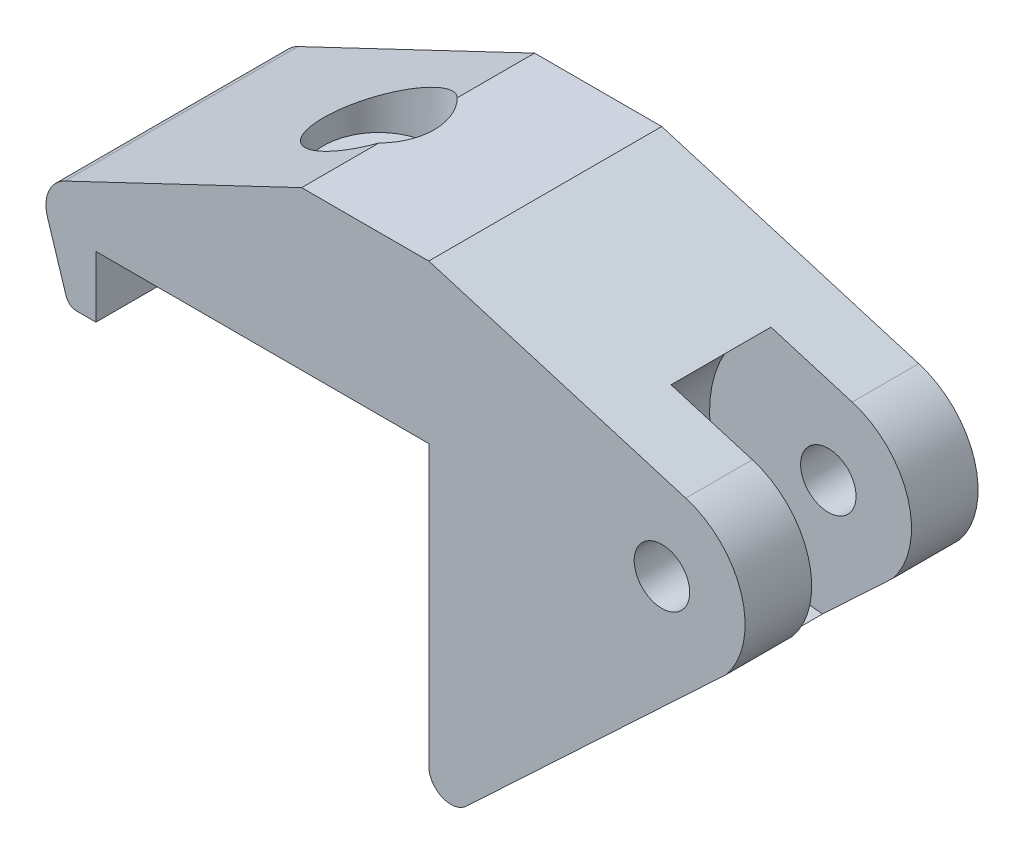
from build123d import *
from build123d.topology import SkipClean

# Parameters (mm, degrees)
RESSALTO_EXTRUS_O1_DEPTH     = 6
RESSALTO_EXTRUS_O2_DEPTH     = 47.171573
CORTE_EXTRUS_O1_START        = -36
CORTE_EXTRUS_O1_DEPTH        = 36
CORTE_EXTRUS_O2_START        = -6
CORTE_EXTRUS_O2_DEPTH        = 6
CORTE_EXTRUS_O3_DEPTH        = 64.000000167
ESBO_O6_R                    = 2.75
CORTE_EXTRUS_O4_DEPTH        = 54.872946739
ESBO_O7_R                    = 5
CORTE_EXTRUS_O5_DEPTH        = 16
RESSALTO_EXTRUS_O3_DEPTH     = 56
CORTE_EXTRUS_O6_DEPTH        = 56
ESBO_O10_W                   = 30
ESBO_O10_H                   = 4.954017116
CORTE_EXTRUS_O7_DEPTH        = 56
ESBO_O11_W                   = 2.729993951
ESBO_O11_H                   = 30
CORTE_EXTRUS_O8_DEPTH        = 56
ESBO_O12_W                   = 4.187219241
ESBO_O12_H                   = 30
CORTE_EXTRUS_O9_DEPTH        = 56
ESBO_O13_R                   = 7.968110823
CORTE_EXTRUS_O10_DEPTH       = 56
FILETE1_R                    = 3
CORTE_EXTRUS_O11_OUTLINE_R   = 5
CORTE_EXTRUS_O11_DEPTH       = 11.574929357
CORTE_EXTRUS_O11_START       = -21
CORTE_EXTRUS_O11_2_DEPTH     = 28
CORTE_EXTRUS_O12_DEPTH       = 65.838260479
ESBO_O16_R                   = 2.5
RESSALTO_EXTRUS_O4_DEPTH     = 6
RESSALTO_EXTRUS_O5_DEPTH     = 32
CORTE_EXTRUS_O13_DEPTH       = 68.468511346
CORTE_EXTRUS_O13_DEPTH_BACK  = 68.468511346
RESSALTO_EXTRUS_O6_START     = -12
RESSALTO_EXTRUS_O6_OUTLINE_R = 2.5
RESSALTO_EXTRUS_O6_DEPTH     = 6
CORTE_EXTRUS_O14_START       = -6
CORTE_EXTRUS_O14_DEPTH       = 6
RESSALTO_EXTRUS_O7_START     = 12
RESSALTO_EXTRUS_O7_DEPTH     = 12
ESBO_O22_R                   = 45.252609104
CORTE_EXTRUS_O15_DEPTH       = 12
RESSALTO_EXTRUS_O8_START     = 6
ESBO_O23_R                   = 2.5
RESSALTO_EXTRUS_O8_DEPTH     = 6
RESSALTO_EXTRUS_O9_DEPTH     = 6
RESSALTO_EXTRUS_O10_REACH    = 56.275
ESBO_O26_R                   = 5
CORTE_EXTRUS_O16_DEPTH       = 47.409919189
ESBO_O27_R                   = 5
ESBO_O27_R_2                 = 2.582746485
RESSALTO_EXTRUS_O11_DEPTH    = 8


with BuildPart() as part:
    # Esboço1 → Ressalto-extrusão1 (new body)
    with BuildSketch(Plane.XY):
        with BuildLine():
            Line((-30, 24), (-2.375117905, 40.574929257))
            ThreePointArc((-2.375117905, 40.574929257), (0.100503831, 41.637149282), (2.769839649, 42))
            Line((2.769839649, 42), (40, 42))
            ThreePointArc((40, 42), (41.414213562, 41.414213562), (42, 40))
            Line((42, 40), (42, 34.828427125))
            ThreePointArc((42, 34.828427125), (41.847759065, 34.06306026), (41.414213562, 33.414213562))
            Line((41.414213562, 33.414213562), (36.670641482, 28.670641482))
            ThreePointArc((36.670641482, 28.670641482), (31.432958847, 25.911210894), (25.552715472, 26.597151419))
            ThreePointArc((25.552715472, 26.597151419), (13.045048712, 24.264475098), (10.712372391, 11.756808337))
            ThreePointArc((10.712372391, 11.756808337), (11.398312916, 5.876564962), (8.638882328, 0.638882328))
            Line((8.638882328, 0.638882328), (8, 0))
            Line((8, 0), (6.2, -1.8))
            Line((6.2, -1.8), (3.414213562, -4.585786438))
            ThreePointArc((3.414213562, -4.585786438), (1.234633135, -5.01933194), (0, -3.171572875))
            Line((0, -3.171572875), (0, 0))
            Line((0, 0), (0, 22))
            Line((0, 22), (-30, 22))
            Line((-30, 22), (-30, 24))
        make_face()
        with BuildLine():
            Line((6.2, 37.5), (6.2, 34.5))
            ThreePointArc((6.2, 34.5), (4.5, 32.8), (2.8, 34.5))
            Line((2.8, 34.5), (2.8, 37.5))
            ThreePointArc((2.8, 37.5), (4.5, 39.2), (6.2, 37.5))
        make_face(mode=Mode.SUBTRACT)
        with BuildLine():
            Line((39.2, 37.5), (39.2, 35.5))
            ThreePointArc((39.2, 35.5), (37.5, 33.8), (35.8, 35.5))
            Line((35.8, 35.5), (35.8, 37.5))
            ThreePointArc((35.8, 37.5), (37.5, 39.2), (39.2, 37.5))
        make_face(mode=Mode.SUBTRACT)
        with BuildLine():
            Line((6.2, 3.5), (6.2, 1.5))
            ThreePointArc((6.2, 1.5), (4.5, -0.2), (2.8, 1.5))
            Line((2.8, 1.5), (2.8, 3.5))
            ThreePointArc((2.8, 3.5), (4.5, 5.2), (6.2, 3.5))
        make_face(mode=Mode.SUBTRACT)
    extrude(amount=RESSALTO_EXTRUS_O1_DEPTH)

    # Esboço2 → Ressalto-extrusão2 (add, through all)
    with BuildSketch(Plane(origin=(0, 42, 0), x_dir=(1, 0, 0), z_dir=(0, 1, 0))):
        with BuildLine():
            Line((-30, 0), (-30, 20))
            ThreePointArc((-30, 20), (5.092783278, 6.734019802), (42, 0))
            Line((42, 0), (-30, 0))
        make_face()
    extrude(amount=-RESSALTO_EXTRUS_O2_DEPTH)

    # Esboço3 → Corte-extrusão1 (cut)
    with BuildSketch(Plane.XY.offset(CORTE_EXTRUS_O1_START)):
        with BuildLine():
            ThreePointArc((2.8, 34.5), (4.5, 32.8), (6.2, 34.5))
            Line((6.2, 34.5), (6.2, 37.5))
            ThreePointArc((6.2, 37.5), (4.5, 39.2), (2.8, 37.5))
            Line((2.8, 37.5), (2.8, 34.5))
        make_face()
        with BuildLine():
            Line((0, -3.171572875), (0, 22))
            Line((0, 22), (-30, 22))
            Line((-30, 22), (-30, -5.171572875))
            Line((-30, -5.171572875), (2, -5.171572875))
            ThreePointArc((2, -5.171572875), (0.585786438, -4.585786438), (0, -3.171572875))
        make_face()
        with BuildLine():
            ThreePointArc((3.414213562, -4.585786438), (2.765366865, -5.01933194), (2, -5.171572875))
            Line((2, -5.171572875), (42, -5.171572875))
            Line((42, -5.171572875), (42, 34.828427125))
            ThreePointArc((42, 34.828427125), (41.847759065, 34.06306026), (41.414213562, 33.414213562))
            Line((41.414213562, 33.414213562), (36.670641482, 28.670641482))
            ThreePointArc((36.670641482, 28.670641482), (31.432958847, 25.911210894), (25.552715472, 26.597151419))
            ThreePointArc((25.552715472, 26.597151419), (13.045048712, 24.264475098), (10.712372391, 11.756808337))
            ThreePointArc((10.712372391, 11.756808337), (11.398312916, 5.876564962), (8.638882328, 0.638882328))
            Line((8.638882328, 0.638882328), (3.414213562, -4.585786438))
        make_face()
        with BuildLine():
            ThreePointArc((35.8, 35.5), (37.5, 33.8), (39.2, 35.5))
            Line((39.2, 35.5), (39.2, 37.5))
            ThreePointArc((39.2, 37.5), (37.5, 39.2), (35.8, 37.5))
            Line((35.8, 37.5), (35.8, 35.5))
        make_face()
        with BuildLine():
            ThreePointArc((2.8, 1.5), (4.5, -0.2), (6.2, 1.5))
            Line((6.2, 1.5), (6.2, 3.5))
            ThreePointArc((6.2, 3.5), (4.5, 5.2), (2.8, 3.5))
            Line((2.8, 3.5), (2.8, 1.5))
        make_face()
        with BuildLine():
            Line((-30, 42), (-30, 24))
            Line((-30, 24), (-2.375117905, 40.574929257))
            ThreePointArc((-2.375117905, 40.574929257), (0.100503831, 41.637149282), (2.769839649, 42))
            Line((2.769839649, 42), (-30, 42))
        make_face()
    extrude(amount=CORTE_EXTRUS_O1_DEPTH, mode=Mode.SUBTRACT)

    # Esboço4 → Corte-extrusão2 (cut)
    with BuildSketch(Plane.XY.offset(CORTE_EXTRUS_O2_START)):
        with BuildLine():
            Line((42, 40), (42, 42))
            Line((42, 42), (40, 42))
            ThreePointArc((40, 42), (41.414213562, 41.414213562), (42, 40))
        make_face()
    extrude(amount=CORTE_EXTRUS_O2_DEPTH, mode=Mode.SUBTRACT)

    # Esboço5 → Corte-extrusão3 (cut, through all)
    with BuildSketch(Plane.XY.offset(1)):
        with BuildLine():
            Line((1.3, 37.5), (1.3, 34.5))
            ThreePointArc((1.3, 34.5), (4.5, 31.3), (7.7, 34.5))
            Line((7.7, 34.5), (7.7, 37.5))
            ThreePointArc((7.7, 37.5), (4.5, 40.7), (1.3, 37.5))
        make_face()
        with BuildLine():
            Line((40.2, 35.5), (40.2, 37.5))
            ThreePointArc((40.2, 37.5), (37.5, 40.2), (34.8, 37.5))
            Line((34.8, 37.5), (34.8, 35.5))
            ThreePointArc((34.8, 35.5), (37.5, 32.8), (40.2, 35.5))
        make_face()
        with BuildLine():
            Line((1.8, 3.5), (1.8, 1.5))
            ThreePointArc((1.8, 1.5), (4.5, -1.2), (7.2, 1.5))
            Line((7.2, 1.5), (7.2, 3.5))
            ThreePointArc((7.2, 3.5), (4.5, 6.2), (1.8, 3.5))
        make_face()
    extrude(amount=-CORTE_EXTRUS_O3_DEPTH, mode=Mode.SUBTRACT)

    # Esboço6 → Corte-extrusão4 (cut, through all)
    with BuildSketch(Plane.XZ.offset(-22)):
        with Locations((-15, -3)):
            Circle(ESBO_O6_R)
    extrude(amount=-CORTE_EXTRUS_O4_DEPTH, mode=Mode.SUBTRACT)

    # Esboço7 → Corte-extrusão5 (cut)
    with BuildSketch(Plane(origin=(0, 29, 0), x_dir=(-1, 0, 0), z_dir=(0, -1, 0))):
        with Locations(Location((15, 3, 0), (0, 0, 180))):
            Circle(ESBO_O7_R)
    extrude(amount=-CORTE_EXTRUS_O5_DEPTH, mode=Mode.SUBTRACT)

    # Esboço8 → Ressalto-extrusão3 (add)
    with BuildSketch(Plane.XY.offset(6)):
        Polygon((-30, 22), (-30, 16.475897374), (-32.468121282, 16.475897374), (-35.151943697, 24.974668355), (-2.375117905, 40.574929257), align=None)
    extrude(amount=-RESSALTO_EXTRUS_O3_DEPTH)

    # Esboço9 → Corte-extrusão6 (cut)
    with BuildSketch(Plane(origin=(-19.527562648, 29.041651157, 0), x_dir=(0.8298484461977135, 0.5579888496585221, 0), z_dir=(0.5579888496585221, -0.8298484461977135, 0))):
        with BuildLine():
            Line((20.669370198, -50), (20.669370198, -8.960218673))
            add(Edge.make_bspline(
                [(20.669370198, -8.960218673), (3.547051305, -13.487974371), (-12.619698693, -20)],
                knots=[1.879279318, 1.879279318, 1.879279318, 2.02269118, 2.02269118, 2.02269118], degree=2, weights=[1, 0.997430231, 1]))
            Line((-12.619698693, -20), (-12.619698693, -50))
            Line((-12.619698693, -50), (20.669370198, -50))
        make_face()
    extrude(amount=-CORTE_EXTRUS_O6_DEPTH, mode=Mode.SUBTRACT)

    # Esboço10 → Corte-extrusão7 (cut)
    with BuildSketch(Plane(origin=(-10.472437352, -7.041651157, 0), x_dir=(0, 0, -1), z_dir=(0.8298484461977135, 0.5579888496585221, 1.5073885260129385e-15))):
        with Locations((35, 37.473339864)):
            Rectangle(ESBO_O10_W, ESBO_O10_H)
    extrude(amount=-CORTE_EXTRUS_O7_DEPTH, mode=Mode.SUBTRACT)

    # Esboço11 → Corte-extrusão8 (cut)
    with BuildSketch(Plane(origin=(-22.291848959, 33.152734563, 0), x_dir=(0.8298484461977135, 0.5579888496585221, 0), z_dir=(0.5579888496585221, -0.8298484461977135, 0))):
        with Locations((-13.984695669, -35)):
            Rectangle(ESBO_O11_W, ESBO_O11_H)
    extrude(amount=-CORTE_EXTRUS_O8_DEPTH, mode=Mode.SUBTRACT)

    # Esboço12 → Corte-extrusão9 (cut)
    with BuildSketch(Plane(origin=(-19.527562648, 29.041651157, 0), x_dir=(0.8298484461977135, 0.5579888496585221, 0), z_dir=(-0.5579888496585221, 0.8298484461977135, 0))):
        with Locations((-14.713308314, 35)):
            Rectangle(ESBO_O12_W, ESBO_O12_H)
    extrude(amount=-CORTE_EXTRUS_O9_DEPTH, mode=Mode.SUBTRACT)

    # Esboço13 → Corte-extrusão10 (cut)
    with BuildSketch(Plane(origin=(0, 0, -20), x_dir=(-1, 0, 0), z_dir=(0, 0, -1))):
        with Locations((34.361612589, 20.650995678)):
            Circle(ESBO_O13_R)
    extrude(amount=CORTE_EXTRUS_O10_DEPTH, mode=Mode.SUBTRACT)

    # Filete1
    filete1_edges = [part.edges().sort_by_distance(p)[0] for p in [
        (-35.151943697, 24.974668355, -7),
    ]]
    fillet(filete1_edges, radius=FILETE1_R)

    # Corte-extrusão11: read off the stored shape, not the designer's step
    # Corte-extrusão11 outline → Corte-extrusão11 (cut)
    with SkipClean():  # the faces are left unmerged after this step: merging them gives an invalid solid
        with BuildSketch(Plane(origin=(0, 29, 0), x_dir=(1, 0, 0), z_dir=(0, 1, 0))):
            with Locations((-15, 3)):
                Circle(CORTE_EXTRUS_O11_OUTLINE_R)
        extrude(amount=CORTE_EXTRUS_O11_DEPTH, mode=Mode.SUBTRACT)

    # Corte-extrus_o11 2 outline → Corte-extrus_o11 2 (cut)
    with SkipClean():  # the faces are left unmerged after this step: merging them gives an invalid solid
        with BuildSketch(Plane.XY.offset(CORTE_EXTRUS_O11_START)):
            with BuildLine():
                ThreePointArc((-31.735233974, 16.475897374), (-32.326363669, 16.669320853), (-32.688816639, 17.174766006))
                Line((-32.688816639, 17.174766006), (-32.468121282, 16.475897374))
                Line((-32.468121282, 16.475897374), (-31.735233974, 16.475897374))
            make_face()
        extrude(amount=CORTE_EXTRUS_O11_2_DEPTH, mode=Mode.SUBTRACT)

    # Esboço15 → Corte-extrusão12 (cut, through all)
    with SkipClean():  # the faces are left unmerged after this step: merging them gives an invalid solid
        with BuildSketch(Plane.XY.offset(6)):
            with BuildLine():
                Line((9.75, 16.30952381), (10, 22.2))
                ThreePointArc((10, 22.2), (16.149553965, 32.072850311), (27.722395139, 30.906859571))
                ThreePointArc((27.722395139, 30.906859571), (33.400143909, 29.493959096), (39.042427522, 31.042427522))
                Line((39.042427522, 31.042427522), (40.056737405, 6.935592927))
                Line((40.056737405, 6.935592927), (14.498143353, 9.675700977))
                Line((14.498143353, 9.675700977), (9.75, 16.30952381))
            make_face()
        extrude(amount=-CORTE_EXTRUS_O12_DEPTH, mode=Mode.SUBTRACT)

    # Esboço16 → Ressalto-extrusão4 (add)
    # profile 1 of 2: a face of its own
    with SkipClean():  # the faces are left unmerged after this step: merging them gives an invalid solid
        with BuildSketch(Plane.XY.offset(6)):
            with BuildLine():
                Line((8.638882328, 0.638882328), (3.414213562, -4.585786438))
                Line((3.414213562, -4.585786438), (25.426690476, 16.071039138))
                Line((25.426690476, 16.071039138), (26.790546671, 17.350901447))
                ThreePointArc((26.790546671, 17.350901447), (28.194594299, 24.31086023), (23.165446705, 29.322850901))
                Line((23.165446705, 29.322850901), (15.374722386, 31.652843581))
                ThreePointArc((15.374722386, 31.652843581), (11.437624412, 27.637000379), (10, 22.2))
                Line((10, 22.2), (9.79045574, 17.262738097))
                ThreePointArc((9.79045574, 17.262738097), (9.904464176, 14.45167969), (10.712372391, 11.756808337))
                ThreePointArc((10.712372391, 11.756808337), (11.398312916, 5.876564962), (8.638882328, 0.638882328))
            make_face()
            with Locations((21.016451551, 22.137322401)):
                Circle(ESBO_O16_R, mode=Mode.SUBTRACT)
        # profile 2 of 2: a face of its own
        with BuildSketch(Plane.XY.offset(6)):
            with BuildLine():
                ThreePointArc((0, -3.171572875), (1.234633135, -5.01933194), (3.414213562, -4.585786438))
                Line((3.414213562, -4.585786438), (8.638882328, 0.638882328))
                ThreePointArc((8.638882328, 0.638882328), (11.398312916, 5.876564962), (10.712372391, 11.756808337))
                ThreePointArc((10.712372391, 11.756808337), (9.904464176, 14.45167969), (9.79045574, 17.262738097))
                Line((9.79045574, 17.262738097), (10, 22.2))
                ThreePointArc((10, 22.2), (11.437624412, 27.637000379), (15.374722386, 31.652843581))
                Line((15.374722386, 31.652843581), (6.196917621, 34.397674105))
                ThreePointArc((6.196917621, 34.397674105), (4.448813845, 32.80077077), (2.8, 34.5))
                Line((2.8, 34.5), (2.8, 35.413599309))
                Line((2.8, 35.413599309), (0, 36.251002769))
                Line((0, 36.251002769), (-11.459875276, 36.251002769))
                Line((-11.459875276, 36.251002769), (-32.794151025, 26.096869176))
                ThreePointArc((-32.794151025, 26.096869176), (-34.255821628, 24.584817567), (-34.365620501, 22.484644901))
                Line((-34.365620501, 22.484644901), (-32.688816639, 17.174766006))
                ThreePointArc((-32.688816639, 17.174766006), (-32.326363669, 16.669320853), (-31.735233974, 16.475897374))
                Line((-31.735233974, 16.475897374), (-30, 16.475897374))
                Line((-30, 16.475897374), (-30, 22))
                Line((-30, 22), (0, 22))
                Line((0, 22), (0, -3.171572875))
            make_face()
            with BuildLine():
                Line((2.8, 1.5), (2.8, 3.5))
                ThreePointArc((2.8, 3.5), (4.5, 5.2), (6.2, 3.5))
                Line((6.2, 3.5), (6.2, 1.5))
                ThreePointArc((6.2, 1.5), (4.5, -0.2), (2.8, 1.5))
            make_face(mode=Mode.SUBTRACT)
        extrude(amount=RESSALTO_EXTRUS_O4_DEPTH)

    # Esboço17 → Ressalto-extrusão5 (add, through all)
    with SkipClean():  # the faces are left unmerged after this step: merging them gives an invalid solid
        with BuildSketch(Plane.XY.offset(12)):
            Polygon((0, 36.251002769), (10.130318386, 33.221301458), (0.975035889, 28.870604343), align=None)
            Polygon((2.084047032, 8.037037864), (2.084047032, -2.498567998), (9.054974219, 1.541401167), (7.781094017, 11.183860023), align=None)
        extrude(amount=-RESSALTO_EXTRUS_O5_DEPTH)

    # Esboço18 → Corte-extrusão13 (cut, two sides: drawn at the far end of the back side and taken through both)
    with BuildSketch(Plane.XY.offset(12).offset(-CORTE_EXTRUS_O13_DEPTH_BACK)):
        Polygon((46.622494025, 46.314856478), (-12.491527995, 46.314856478), (-11.459875276, 36.251002769), (0, 36.251002769), (23.165446705, 29.322850901), (57.534604201, 23.388039005), align=None)
    extrude(amount=CORTE_EXTRUS_O13_DEPTH + CORTE_EXTRUS_O13_DEPTH_BACK, mode=Mode.SUBTRACT)

    # Ressalto-extrusão6: read off the stored shape, not the designer's step
    # Ressalto-extrusão6 outline → Ressalto-extrusão6 (add)
    # profile 1 of 4: a face of its own
    with BuildSketch(Plane.XY.offset(12).offset(RESSALTO_EXTRUS_O6_START)):
        with BuildLine():
            Line((6.920981451, 0.304655358), (4.333572344, -1.194865829))
            ThreePointArc((4.333572344, -1.194865829), (5.853844213, -0.836044916), (6.920981451, 0.304655358))
        make_face()
    # profile 2 of 4: a face of its own
    with BuildSketch(Plane.XY.offset(12).offset(RESSALTO_EXTRUS_O6_START)):
        with BuildLine():
            Line((2.084047032, 0.294524468), (2.084047032, 4.705475532))
            ThreePointArc((2.084047032, 4.705475532), (1.871970984, 4.119244292), (1.8, 3.5))
            Line((1.8, 3.5), (1.8, 1.5))
            ThreePointArc((1.8, 1.5), (1.871970984, 0.880755708), (2.084047032, 0.294524468))
        make_face()
    # profile 3 of 4: a face of its own
    with BuildSketch(Plane.XY.offset(12).offset(RESSALTO_EXTRUS_O6_START)):
        with BuildLine():
            Line((10, 22.2), (9.79045574, 17.262738097))
            ThreePointArc((9.79045574, 17.262738097), (9.904464176, 14.45167969), (10.712372391, 11.756808337))
            ThreePointArc((10.712372391, 11.756808337), (11.398312916, 5.876564962), (8.638882328, 0.638882328))
            Line((8.638882328, 0.638882328), (3.414213562, -4.585786438))
            Line((3.414213562, -4.585786438), (26.790546671, 17.350901447))
            ThreePointArc((26.790546671, 17.350901447), (28.194594299, 24.31086023), (23.165446705, 29.322850901))
            Line((23.165446705, 29.322850901), (15.374722386, 31.652843581))
            ThreePointArc((15.374722386, 31.652843581), (11.437624412, 27.637000379), (10, 22.2))
        make_face()
        with Locations((21.016451551, 22.137322401)):
            Circle(RESSALTO_EXTRUS_O6_OUTLINE_R, mode=Mode.SUBTRACT)
    # profile 4 of 4: a face of its own
    with BuildSketch(Plane.XY.offset(12).offset(RESSALTO_EXTRUS_O6_START)):
        Polygon((-11, 36.251002769), (-11.459875276, 36.251002769), (-11.767511755, 29), (-11, 29), align=None)
    extrude(amount=RESSALTO_EXTRUS_O6_DEPTH)

    # Esboço20 → Corte-extrusão14 (cut)
    with BuildSketch(Plane.XY.offset(12).offset(CORTE_EXTRUS_O14_START)):
        with BuildLine():
            Line((-30, 22), (0, 22))
            Line((0, 22), (0, -3.171572875))
            ThreePointArc((0, -3.171572875), (1.234633135, -5.01933194), (3.414213562, -4.585786438))
            Line((3.414213562, -4.585786438), (26.790546671, 17.350901447))
            ThreePointArc((26.790546671, 17.350901447), (28.194594299, 24.31086023), (23.165446705, 29.322850901))
            Line((23.165446705, 29.322850901), (0, 36.251002769))
            Line((0, 36.251002769), (-11.459875276, 36.251002769))
            Line((-11.459875276, 36.251002769), (-32.794151025, 26.096869176))
            ThreePointArc((-32.794151025, 26.096869176), (-34.255821628, 24.584817567), (-34.365620501, 22.484644901))
            Line((-34.365620501, 22.484644901), (-32.688816639, 17.174766006))
            ThreePointArc((-32.688816639, 17.174766006), (-32.326363669, 16.669320853), (-31.735233974, 16.475897374))
            Line((-31.735233974, 16.475897374), (-30, 16.475897374))
            Line((-30, 16.475897374), (-30, 22))
        make_face()
    extrude(amount=CORTE_EXTRUS_O14_DEPTH, mode=Mode.SUBTRACT)

    # Esboço21 → Ressalto-extrusão7 (add)
    with BuildSketch(Plane(origin=(0, 0, 0), x_dir=(-1, 0, 0), z_dir=(0, 0, -1)).offset(RESSALTO_EXTRUS_O7_START)):
        with BuildLine():
            Line((-3.414213562, -4.585786438), (-20.494190423, 11.442310001))
            ThreePointArc((-20.494190423, 11.442310001), (-10.585084019, 19.720171533), (-15.84350344, 31.512643982))
            Line((-15.84350344, 31.512643982), (-15.374722386, 31.652843581))
            Line((-15.374722386, 31.652843581), (-10.130318386, 33.221301458))
            Line((-10.130318386, 33.221301458), (0, 36.251002769))
            Line((0, 36.251002769), (-3.414213562, 20.694771015))
            Line((-3.414213562, 20.694771015), (0, -3.171572875))
            ThreePointArc((0, -3.171572875), (-1.234633135, -5.01933194), (-3.414213562, -4.585786438))
        make_face()
    extrude(amount=-RESSALTO_EXTRUS_O7_DEPTH)

    # Esboço22 → Corte-extrusão15 (cut)
    with BuildSketch(Plane(origin=(0, 0, -12), x_dir=(-1, 0, 0), z_dir=(0, 0, -1))):
        with Locations((-6.010824173, 18.47613929)):
            Circle(ESBO_O22_R)
    extrude(amount=CORTE_EXTRUS_O15_DEPTH, mode=Mode.SUBTRACT)

    # Esboço23 → Ressalto-extrusão8 (add)
    with BuildSketch(Plane(origin=(0, 0, -9), x_dir=(-1, 0, 0), z_dir=(0, 0, -1)).offset(RESSALTO_EXTRUS_O8_START)):
        with BuildLine():
            Line((30, 22), (30, 16.475897374))
            Line((30, 16.475897374), (31.735233974, 16.475897374))
            ThreePointArc((31.735233974, 16.475897374), (32.326363669, 16.669320853), (32.688816639, 17.174766006))
            Line((32.688816639, 17.174766006), (34.365620501, 22.484644901))
            ThreePointArc((34.365620501, 22.484644901), (34.255821628, 24.584817567), (32.794151025, 26.096869176))
            Line((32.794151025, 26.096869176), (11.459875276, 36.251002769))
            Line((11.459875276, 36.251002769), (0, 36.251002769))
            Line((0, 36.251002769), (-23.165446705, 29.322850901))
            ThreePointArc((-23.165446705, 29.322850901), (-28.194594299, 24.31086023), (-26.790546671, 17.350901447))
            Line((-26.790546671, 17.350901447), (-3.414213562, -4.585786438))
            ThreePointArc((-3.414213562, -4.585786438), (-1.234633135, -5.01933194), (0, -3.171572875))
            Line((0, -3.171572875), (0, 22))
            Line((0, 22), (30, 22))
        make_face()
        with Locations(Location((-21.016451551, 22.137322401, 0), (0, 0, 180))):
            Circle(ESBO_O23_R, mode=Mode.SUBTRACT)
    extrude(amount=-RESSALTO_EXTRUS_O8_DEPTH)

    # Esboço24 → Ressalto-extrusão9 (add)
    with BuildSketch(Plane.XY.offset(-9)):
        Polygon((-2.499823115, 36.251002769), (-2.499823115, 22), (0, 22), (0, -3.171572875), (3.414213562, 20.694771015), (1.558919926, 29.148072853), (0.975035889, 28.870604343), (0, 36.251002769), align=None)
    extrude(amount=RESSALTO_EXTRUS_O9_DEPTH)

    # Esboço25 → Ressalto-extrusão10 (add, up to next)
    with BuildSketch(Plane.XY.offset(6), mode=Mode.PRIVATE) as ressalto_extrus_o10_sk1:
        Polygon((-26.355097468, 22), (-3.712003094, 22), (-3.712003094, 36.251002769), (-11.459875276, 36.251002769), (-28.142320243, 28.310926582), align=None)
    ressalto_extrus_o10_tool1 = extrude(ressalto_extrus_o10_sk1.sketch, amount=-RESSALTO_EXTRUS_O10_REACH, mode=Mode.PRIVATE) - part.part
    add(ressalto_extrus_o10_tool1.solids().sort_by_distance((-14.094848, 28.154372, 6))[0])

    # Esboço26 → Corte-extrusão16 (cut, through all)
    with BuildSketch(Plane.XZ.offset(-22)):
        with Locations((-15, -4.5)):
            Circle(ESBO_O26_R)
    extrude(amount=-CORTE_EXTRUS_O16_DEPTH, mode=Mode.SUBTRACT)

    # Esboço27 → Ressalto-extrusão11 (add)
    with BuildSketch(Plane.XZ.offset(-22)):
        with Locations((-15, -4.5)):
            Circle(ESBO_O27_R)
        with Locations((-15, -4.5)):
            Circle(ESBO_O27_R_2, mode=Mode.SUBTRACT)
    extrude(amount=-RESSALTO_EXTRUS_O11_DEPTH)


solid = part.part
